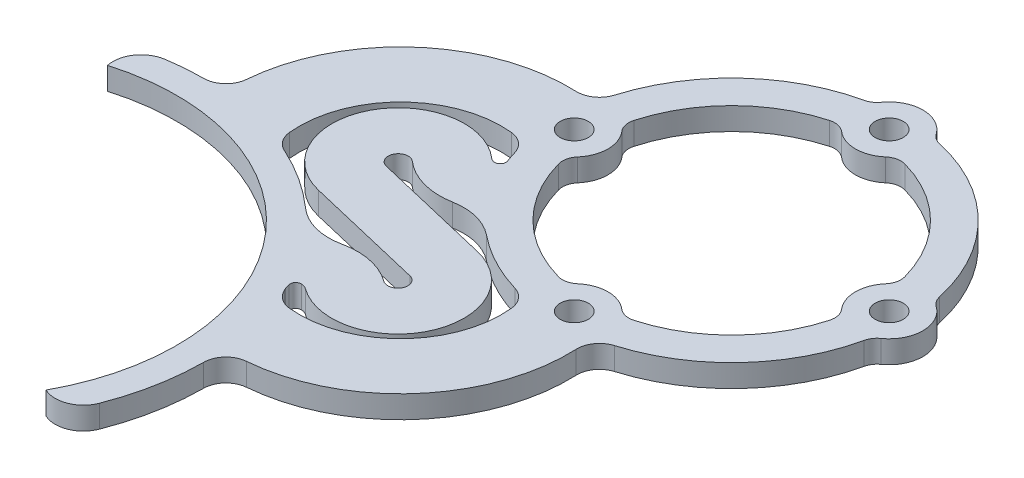
from build123d import *

# Parameters (mm, degrees)
SKETCH1_R           = 2.5
SKETCH1_R_2         = 38.5
BOSS_EXTRUDE1_DEPTH = 4
FILLET1_R           = 3
EXTRUDE_THIN1_DEPTH = 4
FILLET2_R           = 10
FILLET3_R           = 4
FILLET4_R           = 1
SKETCH3_R           = 64.024386015
CUT_EXTRUDE1_DEPTH  = 10
FILLET5_R           = 5
FILLET6_DEPTH       = 4


with BuildPart() as part:
    # Sketch1 → Boss-Extrude1 (new body)
    with BuildSketch(Plane(origin=(0, 0, 0), x_dir=(1, 0, 0), z_dir=(0, 1, 0))):
        with BuildLine():
            ThreePointArc((30.517857143, 5.446135824), (21.920310217, 21.920310217), (5.446135824, 30.517857143))
            ThreePointArc((5.446135824, 30.517857143), (0, 34), (-5.446135824, 30.517857143))
            ThreePointArc((-5.446135824, 30.517857143), (-20.638377106, 23.131307581), (-29.702130488, 8.876003857))
            ThreePointArc((-29.702130488, 8.876003857), (-31.212792428, 6.764161745), (-33.701829376, 6.02478926))
            ThreePointArc((-33.701829376, 6.02478926), (-54.791240945, -1.442417701), (-64.849322602, -21.426347583))
            ThreePointArc((-64.849322602, -21.426347583), (-66.120648036, -24.027926305), (-68.814456997, -25.089940189))
            ThreePointArc((-68.814456997, -25.089940189), (-99.348502757, -99.348502757), (-25.089940189, -68.814456997))
            ThreePointArc((-25.089940189, -68.814456997), (-24.027926305, -66.120648036), (-21.426347583, -64.849322602))
            ThreePointArc((-21.426347583, -64.849322602), (-1.442417701, -54.791240945), (6.02478926, -33.701829376))
            ThreePointArc((6.02478926, -33.701829376), (6.764161745, -31.212792428), (8.876003857, -29.702130488))
            ThreePointArc((8.876003857, -29.702130488), (23.131307581, -20.638377106), (30.517857143, -5.446135824))
            ThreePointArc((30.517857143, -5.446135824), (34, 0), (30.517857143, 5.446135824))
        make_face()
        with Locations(Location((0, 28, 0), (0, 0, 270))):
            Circle(SKETCH1_R, mode=Mode.SUBTRACT)
        with Locations(Location((28, 0, 0), (0, 0, 270))):
            Circle(SKETCH1_R, mode=Mode.SUBTRACT)
        with Locations(Location((0, -28, 0), (0, 0, 270))):
            Circle(SKETCH1_R, mode=Mode.SUBTRACT)
        with Locations(Location((-28, 0, 0), (0, 0, 270))):
            Circle(SKETCH1_R, mode=Mode.SUBTRACT)
        with Locations(Location((-68.589357775, -68.589357775, 0), (0, 0, 270))):
            Circle(SKETCH1_R_2, mode=Mode.SUBTRACT)
        with BuildLine():
            ThreePointArc((-24.517857143, -4.886172441), (-17.67766953, -17.67766953), (-4.886172441, -24.517857143))
            ThreePointArc((-4.886172441, -24.517857143), (0, -22), (4.886172441, -24.517857143))
            ThreePointArc((4.886172441, -24.517857143), (17.67766953, -17.67766953), (24.517857143, -4.886172441))
            ThreePointArc((24.517857143, -4.886172441), (22, 0), (24.517857143, 4.886172441))
            ThreePointArc((24.517857143, 4.886172441), (17.67766953, 17.67766953), (4.886172441, 24.517857143))
            ThreePointArc((4.886172441, 24.517857143), (0, 22), (-4.886172441, 24.517857143))
            ThreePointArc((-4.886172441, 24.517857143), (-17.67766953, 17.67766953), (-24.517857143, 4.886172441))
            ThreePointArc((-24.517857143, 4.886172441), (-22, 0), (-24.517857143, -4.886172441))
        make_face(mode=Mode.SUBTRACT)
        with BuildLine():
            ThreePointArc((-50.542739629, -29.009444012), (-37.830212793, -37.830212793), (-29.009444012, -50.542739629))
            ThreePointArc((-29.009444012, -50.542739629), (-27.701648922, -52.133357655), (-25.775886095, -52.862625259))
            ThreePointArc((-25.775886095, -52.862625259), (-11.221079312, -47.683495854), (-6.041949907, -33.128689072))
            ThreePointArc((-6.041949907, -33.128689072), (-6.938958159, -30.985310284), (-8.876003857, -29.702130488))
            ThreePointArc((-8.876003857, -29.702130488), (-21.920310217, -21.920310217), (-29.702130488, -8.876003857))
            ThreePointArc((-29.702130488, -8.876003857), (-30.985310284, -6.938958159), (-33.128689072, -6.041949907))
            ThreePointArc((-33.128689072, -6.041949907), (-47.683495854, -11.221079312), (-52.862625259, -25.775886095))
            ThreePointArc((-52.862625259, -25.775886095), (-52.133357655, -27.701648922), (-50.542739629, -29.009444012))
        make_face(mode=Mode.SUBTRACT)
    extrude(amount=BOSS_EXTRUDE1_DEPTH)

    # Fillet1
    fillet1_edges = [part.edges().sort_by_distance(p)[0] for p in [
        (5.446135824, 2, -30.517857143),
        (30.517857143, 2, -5.446135824),
        (30.517857143, 2, 5.446135824),
        (-5.446135824, 2, -30.517857143),
        (24.517857143, 2, -4.886172441),
        (4.886172441, 2, -24.517857143),
        (-4.886172441, 2, -24.517857143),
        (-24.517857143, 2, -4.886172441),
        (-24.517857143, 2, 4.886172441),
        (-4.886172441, 2, 24.517857143),
        (4.886172441, 2, 24.517857143),
        (24.517857143, 2, 4.886172441),
    ]]
    fillet(fillet1_edges, radius=FILLET1_R)

    # Sketch2 → Extrude-Thin1 (add)
    with BuildSketch(Plane(origin=(0, 4, 0), x_dir=(1, 0, 0), z_dir=(0, 1, 0))):
        with BuildLine():
            Line((-32.237774047, -50.35980695), (-29.529509942, -48.389301254))
            ThreePointArc((-29.529509942, -48.389301254), (-28.482745443, -48.04910113), (-27.43634696, -48.390425395))
            ThreePointArc((-27.43634696, -48.390425395), (-9.798865492, -43.800084833), (-17.778530097, -27.414819141))
            Line((-17.778530097, -27.414819141), (-39.072120949, -22.36364217))
            ThreePointArc((-39.072120949, -22.36364217), (-40.242802597, -19.82149687), (-37.49426164, -19.293746119))
            ThreePointArc((-37.49426164, -19.293746119), (-30.900503465, -22.135181432), (-23.882232512, -20.620165146))
            Line((-23.882232512, -20.620165146), (-21.436410838, -19.212144584))
            Line((-21.436410838, -19.212144584), (-26.425576805, -10.545644543))
            Line((-26.425576805, -10.545644543), (-28.871398479, -11.953665105))
            ThreePointArc((-28.871398479, -11.953665105), (-29.930650966, -12.182323243), (-30.925832655, -11.753471545))
            ThreePointArc((-30.925832655, -11.753471545), (-49.13679313, -15.250180603), (-41.380227899, -32.093628928))
            Line((-41.380227899, -32.093628928), (-20.086637047, -37.144805898))
            ThreePointArc((-20.086637047, -37.144805898), (-18.882283492, -39.617798683), (-21.5442705, -40.310608876))
            ThreePointArc((-21.5442705, -40.310608876), (-28.477374908, -38.049102572), (-35.412904416, -40.303160675))
            Line((-35.412904416, -40.303160675), (-38.121168521, -42.273666371))
            Line((-38.121168521, -42.273666371), (-32.237774047, -50.35980695))
        make_face()
    extrude(amount=-EXTRUDE_THIN1_DEPTH)

    # Fillet2
    fillet2_edges = [part.edges().sort_by_distance(p)[0] for p in [
        (-23.394596499, 2, 20.339440864),
    ]]
    fillet(fillet2_edges, radius=FILLET2_R)

    # Fillet3
    # the kernel refuses this fillet: 4 mm, written as the material it adds along each edge
    with BuildSketch(Plane(origin=(-28.654487562, 4, 11.828792947), x_dir=(-0.3625938431900147, 0, -0.9319472650749584), z_dir=(0, -1, 0))) as fillet3_piece_1:
        with BuildLine():
            CenterArc((1.34953067, -3.999163717), FILLET3_R, 91.171633345, 19.12091028)
            Line((-0.037723703, -0.247427412), (-0.065468791, -0.172392686))
            ThreePointArc((-0.065468791, -0.172392686), (-0.097947947, -0.111655946), (-0.079086095, 0.01205776))
            Line((-0.079086095, 0.01205776), (0.001635795, 0.079983274))
            ThreePointArc((0.001635795, 0.079983274), (0.633870466, 0.07351881), (1.266105138, 0.079983274))
            Line((1.266105138, 0.079983274), (1.267740932, 0))
        make_face()
    extrude(amount=4)
    with BuildSketch(Plane(origin=(-29.917309098, 4, 48.671460016), x_dir=(0.8086140578930259, 0, -0.5883394474092097), z_dir=(0, -1, 0))) as fillet3_piece_2:
        with BuildLine():
            CenterArc((3.628329627, 2.4668618), FILLET3_R, 191.061242736, 27.015431221)
            Line((-0.29736105, 1.69942926), (-0.375874864, 1.684080609))
            ThreePointArc((-0.375874864, 1.684080609), (-0.219057332, 0.837400307), (-0.079060684, -0.012223264))
            Line((-0.079060684, -0.012223264), (0, -0.08))
            ThreePointArc((0, -0.08), (0.23979249, -0.08), (0.416610086, -0.049337236))
            Line((0.416610086, -0.049337236), (0.479584979, 0))
        make_face()
    extrude(amount=4)

    # Fillet4
    fillet4_edges = [part.edges().sort_by_distance(p)[0] for p in [
        (-28.871398479, 2, 11.953665105),
        (-29.529509942, 2, 48.389301254),
    ]]
    fillet(fillet4_edges, radius=FILLET4_R)

    # Sketch3 → Cut-Extrude1 (cut)
    with BuildSketch(Plane(origin=(0, 4, 0), x_dir=(1, 0, 0), z_dir=(0, 1, 0))):
        with Locations((-98.613587898, -92.689059133)):
            Circle(SKETCH3_R)
    extrude(amount=-CUT_EXTRUDE1_DEPTH, mode=Mode.SUBTRACT)

    # Fillet5
    # the kernel refuses this fillet: 5 mm, written as the material it takes off along each edge
    with BuildSketch(Plane(origin=(-34.665740184, 37.003417613, 95.818720043), x_dir=(0.5003791783842261, 0, -0.865806374335236), z_dir=(0, -1, 0))) as fillet5_piece_1:
        with BuildLine():
            CenterArc((12.44266779, -4.94210233), FILLET5_R, 81.272233046, 93.723124761)
            Line((7.461729623, -4.505920051), (7.36211086, -4.497196406))
            ThreePointArc((7.36211086, -4.497196406), (3.755943973, -2.211429345), (-0.045745837, -0.088923104))
            Line((-0.045745837, -0.088923104), (-0.015173985, 0.098842047))
            ThreePointArc((-0.015173985, 0.098842047), (6.600683523, 0.603709729), (13.21654103, 0.098842047))
            Line((13.21654103, 0.098842047), (13.201367045, 0))
        make_face()
    extrude(amount=70.006835226, mode=Mode.SUBTRACT)
    with BuildSketch(Plane(origin=(-87.835142464, 37.003417613, 29.578464787), x_dir=(0.9719808160710193, 0, 0.23506019056810815), z_dir=(0, -1, 0))) as fillet5_piece_2:
        with BuildLine():
            CenterArc((13.205988808, -2.20141245), FILLET5_R, 153.878093502, 93.723124761)
            Line((11.300735218, -6.82418313), (11.262630146, -6.916638544))
            ThreePointArc((11.262630146, -6.916638544), (5.338291917, -3.928883786), (-0.064083773, -0.076767636))
            Line((-0.064083773, -0.076767636), (0.006807322, 0.099768033))
            ThreePointArc((0.006807322, 0.099768033), (4.358346145, -0.048515583), (8.62690636, 0.044028249))
            Line((8.62690636, 0.044028249), (8.71669229, 0))
        make_face()
    extrude(amount=70.006835226, mode=Mode.SUBTRACT)

    # Fillet6: read off the stored shape, not the designer's step
    # Fillet6 outline → Fillet6 (add)
    with BuildSketch(Plane(origin=(0, 0, 0), x_dir=(1, 0, 0), z_dir=(0, 1, 0))):
        with BuildLine():
            ThreePointArc((-30.985608924, -38.317908864), (-35.637111816, -38.221540359), (-39.741582528, -36.03085868))
            ThreePointArc((-39.741582528, -36.03085868), (-37.541405134, -38.121757988), (-35.492388329, -40.36099237))
            Line((-35.492388329, -40.36099237), (-35.412904416, -40.303160675))
            ThreePointArc((-35.412904416, -40.303160675), (-33.302598309, -39.080073338), (-30.985608924, -38.317908864))
        make_face()
    extrude(amount=FILLET6_DEPTH)


solid = part.part
